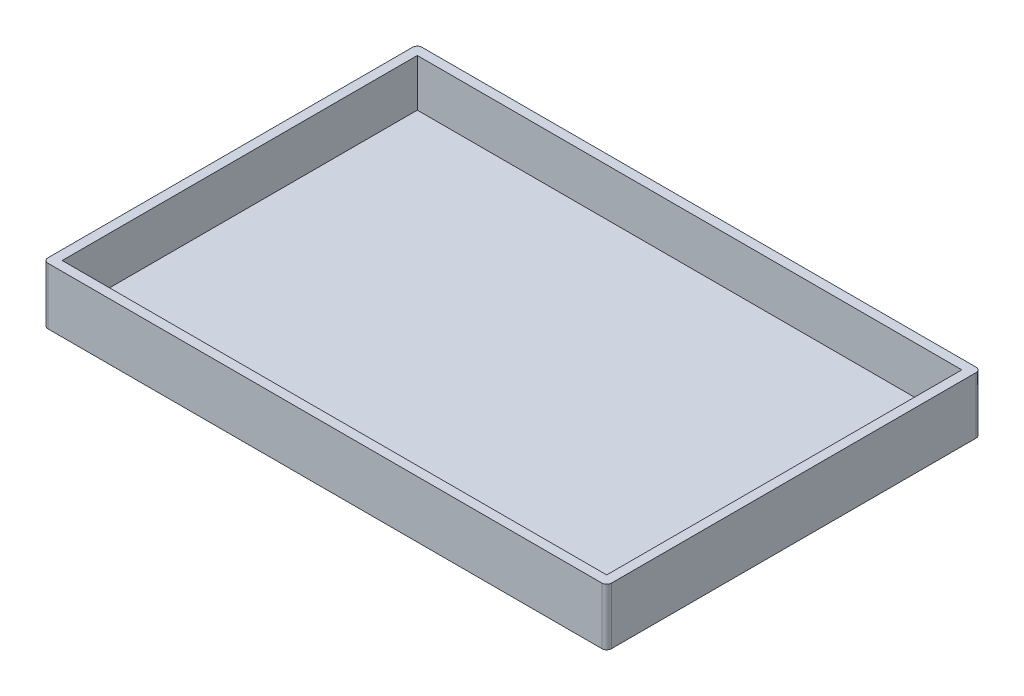
from build123d import *

# Parameters (mm, degrees)
SKETCH1_W           = 115
SKETCH1_H           = 75
BOSS_EXTRUDE1_DEPTH = 10
SHELL1_T            = 2
FILLET1_R           = 1


with BuildPart() as part:
    # Sketch1 → Boss-Extrude1 (new body)
    with BuildSketch(Plane(origin=(0, 0, 0), x_dir=(1, 0, 0), z_dir=(0, 1, 0))):
        Rectangle(SKETCH1_W, SKETCH1_H)
    extrude(amount=BOSS_EXTRUDE1_DEPTH)

    # Shell1
    shell1_openings = [part.faces().sort_by_distance(p)[0] for p in [
        (0, 10, 0),
    ]]
    offset(amount=SHELL1_T, openings=shell1_openings, kind=Kind.INTERSECTION)

    # Fillet1
    # the kernel refuses this fillet: 1 mm, written as the material it takes off along each edge
    with BuildSketch(Plane(origin=(59.5, -4.5, 39.5), x_dir=(-1, 0, 0), z_dir=(0, 1, 0)), Plane(origin=(-59.5, 12.5, 39.5), x_dir=(1, 0, 0), z_dir=(0, -1, 0)), Plane(origin=(-59.5, -4.5, -39.5), x_dir=(1, 0, 0), z_dir=(0, 1, 0)), Plane(origin=(59.5, -4.5, -39.5), x_dir=(0, 0, 1), z_dir=(0, 1, 0))) as fillet1_piece_1:
        with BuildLine():
            CenterArc((FILLET1_R, -FILLET1_R), FILLET1_R, 90, 90)
            Line((0, -FILLET1_R), (0, 0))
            Line((0, 0), (FILLET1_R, 0))
        make_face()
    extrude(amount=17, mode=Mode.SUBTRACT)


solid = part.part
